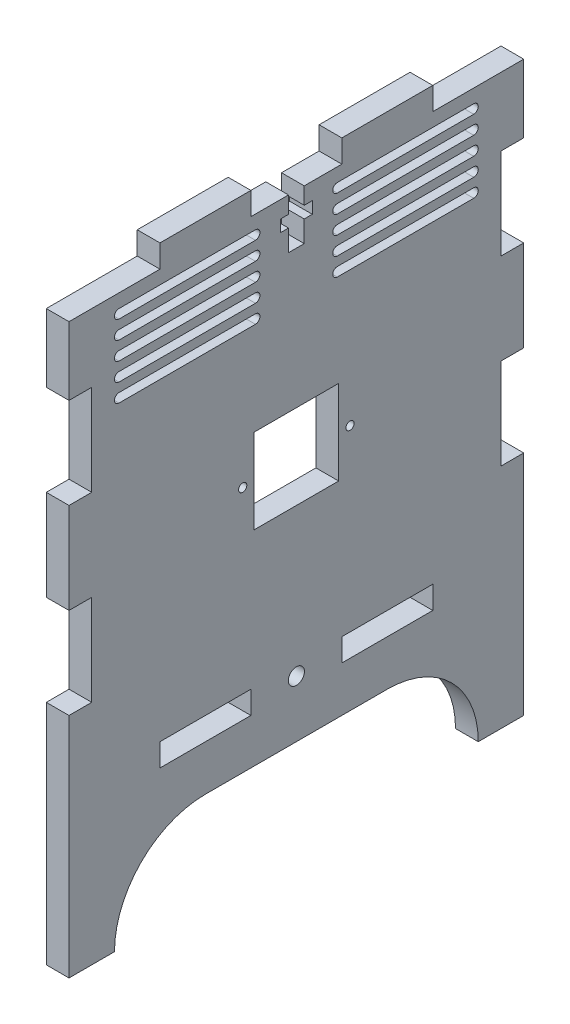
from build123d import *

# Parameters (mm, degrees)
SKETCH1_W                 = 127
SKETCH1_H                 = 165.1
BOSS_EXTRUDE1_DEPTH       = 6.35
SKETCH2_W                 = 25.4
SKETCH2_H                 = 6.35
CUT_EXTRUDE1_DEPTH        = 6.35
LPATTERN1_COUNT           = 3
LPATTERN1_PITCH           = 50.8
CUT_EXTRUDE4_DEPTH        = 6.35
SKETCH8_W                 = 6.35
SKETCH8_H                 = 25.4
CUT_EXTRUDE6_DEPTH        = 6.35
LPATTERN4_COUNT           = 2
LPATTERN4_PITCH           = 50.8
MIRROR1_COPY_1_SKETCH_W   = 6.35
MIRROR1_COPY_1_SKETCH_H   = 25.4
MIRROR1_COPY_1_DEPTH      = 6.35
MIRROR1_COPY_2_SKETCH_W   = 6.35
MIRROR1_COPY_2_SKETCH_H   = 25.4
MIRROR1_COPY_2_DEPTH      = 6.35
SKETCH9_W                 = 25.4
SKETCH9_H                 = 6.35
CUT_EXTRUDE7_DEPTH        = 6.35
LPATTERN6_COUNT           = 2
LPATTERN6_PITCH           = 50.8
SKETCH16_W                = 4.3942
SKETCH16_H                = 13.97
SKETCH16_W_2              = 8.89
SKETCH16_H_2              = 3.302
CUT_EXTRUDE14_DEPTH       = 6.35
F_8_CLEARANCE_HOLE1_D     = 4.4958
F_8_CLEARANCE_HOLE1_DEPTH = 10.16
F_8_CLEARANCE_HOLE1_TIP   = 1.350674586
CUT_EXTRUDE15_DEPTH       = 6.35
LPATTERN7_COPY_1_DEPTH    = 6.35
LPATTERN7_COPY_2_DEPTH    = 6.35
LPATTERN7_COPY_3_DEPTH    = 6.35
LPATTERN7_COPY_4_DEPTH    = 6.35
LPATTERN7_COPY_5_DEPTH    = 6.35
LPATTERN7_COPY_6_DEPTH    = 6.35
LPATTERN7_COPY_7_DEPTH    = 6.35
LPATTERN7_COPY_8_DEPTH    = 6.35
SKETCH20_R                = 1.143
SKETCH20_W                = 23.622
SKETCH20_H                = 23.622
CUT_EXTRUDE16_DEPTH       = 10.16


with BuildPart() as part:
    # Sketch1 → Boss-Extrude1 (new body)
    with BuildSketch(Plane(origin=(0, 0, 0), x_dir=(0, 0, -1), z_dir=(1, 0, 0))):
        Rectangle(SKETCH1_W, SKETCH1_H)
    extrude(amount=BOSS_EXTRUDE1_DEPTH)

    # Sketch2 → Cut-Extrude1 (cut)
    with BuildSketch(Plane(origin=(6.35, 0, 0), x_dir=(0, 0, -1), z_dir=(1, 0, 0))):
        with Locations((-50.8, 79.375)):
            Rectangle(SKETCH2_W, SKETCH2_H)
    cut_extrude1 = extrude(amount=-CUT_EXTRUDE1_DEPTH, mode=Mode.SUBTRACT)

    # LPattern1: Cut-Extrude1 ×3
    with Locations(*[(0, 0, -i * LPATTERN1_PITCH) for i in range(1, LPATTERN1_COUNT)]):
        add(cut_extrude1, mode=Mode.SUBTRACT)

    # Sketch5 → Cut-Extrude4 (cut)
    with BuildSketch(Plane(origin=(6.35, 0, 0), x_dir=(0, 0, -1), z_dir=(1, 0, 0))):
        with BuildLine():
            Line((-25.4, -57.15), (25.4, -57.15))
            ThreePointArc((25.4, -57.15), (50.8, -82.55), (25.4, -107.95))
            Line((25.4, -107.95), (-25.4, -107.95))
            ThreePointArc((-25.4, -107.95), (-50.8, -82.55), (-25.4, -57.15))
        make_face()
    extrude(amount=-CUT_EXTRUDE4_DEPTH, mode=Mode.SUBTRACT)

    # Sketch8 → Cut-Extrude6 (cut)
    with BuildSketch(Plane(origin=(6.35, 0, 0), x_dir=(0, 0, -1), z_dir=(1, 0, 0))):
        with Locations((60.325, 44.45)):
            Rectangle(SKETCH8_W, SKETCH8_H)
    cut_extrude6 = extrude(amount=-CUT_EXTRUDE6_DEPTH, mode=Mode.SUBTRACT)

    # LPattern4: Cut-Extrude6 ×2
    with Locations(*[(0, -i * LPATTERN4_PITCH, 0) for i in range(1, LPATTERN4_COUNT)]):
        add(cut_extrude6, mode=Mode.SUBTRACT)

    # Mirror1 copy 1 sketch → Mirror1 copy 1 (cut)
    with BuildSketch(Plane(origin=(6.35, -50.8, 0), x_dir=(0, 0, 1), z_dir=(1, 0, 0))):
        with Locations((60.325, -44.45)):
            Rectangle(MIRROR1_COPY_1_SKETCH_W, MIRROR1_COPY_1_SKETCH_H)
    extrude(amount=-MIRROR1_COPY_1_DEPTH, mode=Mode.SUBTRACT)

    # Mirror1 copy 2 sketch → Mirror1 copy 2 (cut)
    with BuildSketch(Plane(origin=(6.35, 0, 0), x_dir=(0, 0, 1), z_dir=(1, 0, 0))):
        with Locations((60.325, -44.45)):
            Rectangle(MIRROR1_COPY_2_SKETCH_W, MIRROR1_COPY_2_SKETCH_H)
    extrude(amount=-MIRROR1_COPY_2_DEPTH, mode=Mode.SUBTRACT)

    # Sketch9 → Cut-Extrude7 (cut)
    with BuildSketch(Plane.ZY):
        with Locations((-25.4, -41.275)):
            Rectangle(SKETCH9_W, SKETCH9_H)
    cut_extrude7 = extrude(amount=-CUT_EXTRUDE7_DEPTH, mode=Mode.SUBTRACT)

    # LPattern6: Cut-Extrude7 ×2
    with Locations(*[(0, 0, i * LPATTERN6_PITCH) for i in range(1, LPATTERN6_COUNT)]):
        add(cut_extrude7, mode=Mode.SUBTRACT)

    # Sketch16 → Cut-Extrude14 (cut)
    with BuildSketch(Plane.ZY):
        with Locations((0, 69.215)):
            Rectangle(SKETCH16_W, SKETCH16_H)
        with Locations((0, 69.85)):
            Rectangle(SKETCH16_W_2, SKETCH16_H_2)
    extrude(amount=-CUT_EXTRUDE14_DEPTH, mode=Mode.SUBTRACT)

    # #8 Clearance Hole1
    with Locations(Plane.ZY):
        with Locations((0, -41.275)):
            Hole(F_8_CLEARANCE_HOLE1_D / 2, depth=F_8_CLEARANCE_HOLE1_DEPTH)
            with Locations((0, 0, -(F_8_CLEARANCE_HOLE1_DEPTH + F_8_CLEARANCE_HOLE1_TIP / 2))):  # 118° drill point
                Cone(0, F_8_CLEARANCE_HOLE1_D / 2, F_8_CLEARANCE_HOLE1_TIP, mode=Mode.SUBTRACT)

    # Sketch19 → Cut-Extrude15 (cut)
    with BuildSketch(Plane.ZY):
        with BuildLine():
            Line((-49.53, 72.39), (-11.43, 72.39))
            ThreePointArc((-11.43, 72.39), (-10.16, 71.12), (-11.43, 69.85))
            Line((-11.43, 69.85), (-49.53, 69.85))
            ThreePointArc((-49.53, 69.85), (-50.8, 71.12), (-49.53, 72.39))
        make_face()
    cut_extrude15 = extrude(amount=-CUT_EXTRUDE15_DEPTH, mode=Mode.SUBTRACT)

    # Mirror2: Cut-Extrude15 across plane
    add(cut_extrude15.mirror(Plane.XY), mode=Mode.SUBTRACT)

    # LPattern7 copy 1 sketch → LPattern7 copy 1 (cut)
    with BuildSketch(Plane(origin=(0, -5.08, 0), x_dir=(0, 0, -1), z_dir=(-1, 0, 0))):
        with BuildLine():
            Line((-49.53, -72.39), (-11.43, -72.39))
            ThreePointArc((-11.43, -72.39), (-10.16, -71.12), (-11.43, -69.85))
            Line((-11.43, -69.85), (-49.53, -69.85))
            ThreePointArc((-49.53, -69.85), (-50.8, -71.12), (-49.53, -72.39))
        make_face()
    extrude(amount=-LPATTERN7_COPY_1_DEPTH, mode=Mode.SUBTRACT)

    # LPattern7 copy 2 sketch → LPattern7 copy 2 (cut)
    with BuildSketch(Plane(origin=(0, -10.16, 0), x_dir=(0, 0, -1), z_dir=(-1, 0, 0))):
        with BuildLine():
            Line((-49.53, -72.39), (-11.43, -72.39))
            ThreePointArc((-11.43, -72.39), (-10.16, -71.12), (-11.43, -69.85))
            Line((-11.43, -69.85), (-49.53, -69.85))
            ThreePointArc((-49.53, -69.85), (-50.8, -71.12), (-49.53, -72.39))
        make_face()
    extrude(amount=-LPATTERN7_COPY_2_DEPTH, mode=Mode.SUBTRACT)

    # LPattern7 copy 3 sketch → LPattern7 copy 3 (cut)
    with BuildSketch(Plane(origin=(0, -15.24, 0), x_dir=(0, 0, -1), z_dir=(-1, 0, 0))):
        with BuildLine():
            Line((-49.53, -72.39), (-11.43, -72.39))
            ThreePointArc((-11.43, -72.39), (-10.16, -71.12), (-11.43, -69.85))
            Line((-11.43, -69.85), (-49.53, -69.85))
            ThreePointArc((-49.53, -69.85), (-50.8, -71.12), (-49.53, -72.39))
        make_face()
    extrude(amount=-LPATTERN7_COPY_3_DEPTH, mode=Mode.SUBTRACT)

    # LPattern7 copy 4 sketch → LPattern7 copy 4 (cut)
    with BuildSketch(Plane(origin=(0, -20.32, 0), x_dir=(0, 0, -1), z_dir=(-1, 0, 0))):
        with BuildLine():
            Line((-49.53, -72.39), (-11.43, -72.39))
            ThreePointArc((-11.43, -72.39), (-10.16, -71.12), (-11.43, -69.85))
            Line((-11.43, -69.85), (-49.53, -69.85))
            ThreePointArc((-49.53, -69.85), (-50.8, -71.12), (-49.53, -72.39))
        make_face()
    extrude(amount=-LPATTERN7_COPY_4_DEPTH, mode=Mode.SUBTRACT)

    # LPattern7 copy 5 sketch → LPattern7 copy 5 (cut)
    with BuildSketch(Plane(origin=(0, -5.08, 0), x_dir=(0, 0, 1), z_dir=(-1, 0, 0))):
        with BuildLine():
            Line((-49.53, 72.39), (-11.43, 72.39))
            ThreePointArc((-11.43, 72.39), (-10.16, 71.12), (-11.43, 69.85))
            Line((-11.43, 69.85), (-49.53, 69.85))
            ThreePointArc((-49.53, 69.85), (-50.8, 71.12), (-49.53, 72.39))
        make_face()
    extrude(amount=-LPATTERN7_COPY_5_DEPTH, mode=Mode.SUBTRACT)

    # LPattern7 copy 6 sketch → LPattern7 copy 6 (cut)
    with BuildSketch(Plane(origin=(0, -10.16, 0), x_dir=(0, 0, 1), z_dir=(-1, 0, 0))):
        with BuildLine():
            Line((-49.53, 72.39), (-11.43, 72.39))
            ThreePointArc((-11.43, 72.39), (-10.16, 71.12), (-11.43, 69.85))
            Line((-11.43, 69.85), (-49.53, 69.85))
            ThreePointArc((-49.53, 69.85), (-50.8, 71.12), (-49.53, 72.39))
        make_face()
    extrude(amount=-LPATTERN7_COPY_6_DEPTH, mode=Mode.SUBTRACT)

    # LPattern7 copy 7 sketch → LPattern7 copy 7 (cut)
    with BuildSketch(Plane(origin=(0, -15.24, 0), x_dir=(0, 0, 1), z_dir=(-1, 0, 0))):
        with BuildLine():
            Line((-49.53, 72.39), (-11.43, 72.39))
            ThreePointArc((-11.43, 72.39), (-10.16, 71.12), (-11.43, 69.85))
            Line((-11.43, 69.85), (-49.53, 69.85))
            ThreePointArc((-49.53, 69.85), (-50.8, 71.12), (-49.53, 72.39))
        make_face()
    extrude(amount=-LPATTERN7_COPY_7_DEPTH, mode=Mode.SUBTRACT)

    # LPattern7 copy 8 sketch → LPattern7 copy 8 (cut)
    with BuildSketch(Plane(origin=(0, -20.32, 0), x_dir=(0, 0, 1), z_dir=(-1, 0, 0))):
        with BuildLine():
            Line((-49.53, 72.39), (-11.43, 72.39))
            ThreePointArc((-11.43, 72.39), (-10.16, 71.12), (-11.43, 69.85))
            Line((-11.43, 69.85), (-49.53, 69.85))
            ThreePointArc((-49.53, 69.85), (-50.8, 71.12), (-49.53, 72.39))
        make_face()
    extrude(amount=-LPATTERN7_COPY_8_DEPTH, mode=Mode.SUBTRACT)

    # Sketch20 → Cut-Extrude16 (cut)
    with BuildSketch(Plane.ZY):
        with Locations((-14.986, 11.811)):
            Circle(SKETCH20_R)
        with Locations((14.986, 11.811)):
            Circle(SKETCH20_R)
        with Locations((0, 11.811)):
            Rectangle(SKETCH20_W, SKETCH20_H)
    extrude(amount=-CUT_EXTRUDE16_DEPTH, mode=Mode.SUBTRACT)


solid = part.part
